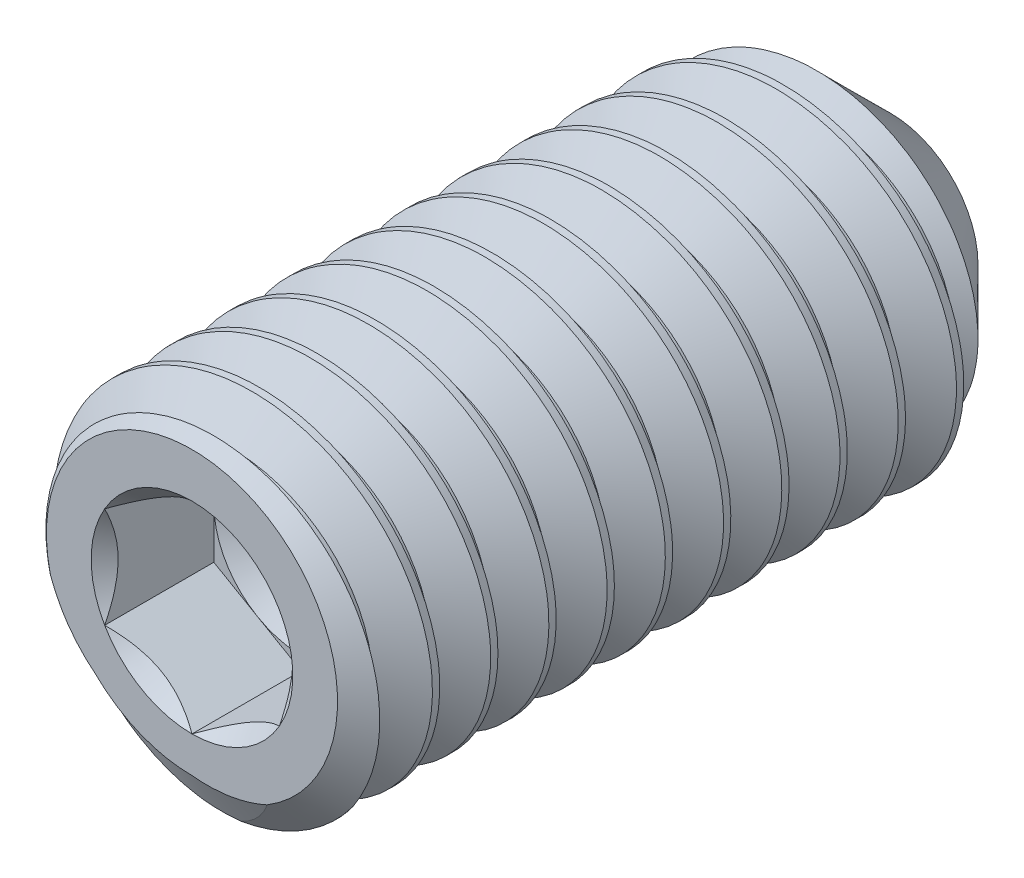
from build123d import *

# Parameters (mm, degrees)
CUT_EXTRUDE1_DEPTH = 0.9375
CUT_SWEEP1_PITCH   = 0.5


with BuildPart() as part:
    # Sketch11 → Revolve1 (revolve)
    with BuildSketch(Plane(origin=(0, 0, 0), x_dir=(0, 0, -1), z_dir=(1, 0, 0)), mode=Mode.PRIVATE) as revolve1_sk:
        Polygon((-3, 0), (-3, 1.25), (-2.824948115, 1.5), (2.25, 1.5), (3, 0.75), (2.549354536, 0), align=None)
    revolve(revolve1_sk.sketch.rotate(Axis((0, 0, -2.549354536), (0, 0, -1)), 180), axis=Axis((0, 0, -2.549354536), (0, 0, -1)))

    # Sketch2 → Cut-Extrude1 (cut)
    with BuildSketch(Plane.XY.offset(3)):
        Polygon((0, 0.866025404), (-0.75, 0.433012702), (-0.75, -0.433012702), (0, -0.866025404), (0.75, -0.433012702), (0.75, 0.433012702), align=None)
    extrude(amount=-CUT_EXTRUDE1_DEPTH, mode=Mode.SUBTRACT)

    # Cut-Extrude2 cone 1 section (through the dimple's axis) → Cut-Extrude2 (revolve, cut)
    with BuildSketch(Plane(origin=(0, 0, 3), x_dir=(0, -1, 0), z_dir=(1, 0, 0))):
        Polygon((0, 0), (0.866025404, 0), (0, 0.866025404), align=None)
    revolve(axis=Axis((0, 0, 3), (0, 0, -1)), mode=Mode.SUBTRACT)

    # Cut-Extrude3 cone 1 section (through the dimple's axis) → Cut-Extrude3 (revolve, cut)
    with BuildSketch(Plane(origin=(0, 0, 2.0625), x_dir=(0, -1, 0), z_dir=(1, 0, 0))):
        Polygon((0, 0), (0.75, 0), (0, 0.433012702), align=None)
    revolve(axis=Axis((0, 0, 2.0625), (0, 0, -1)), mode=Mode.SUBTRACT)

    # Cut-Sweep1: the profile of Sketch6 screwed along a right-hand helix of 13.2 turns, 6 arcs to a turn; built about Z, then put on its axis
    cut_sweep1_z = Axis((0, 0, 0), (0, 0, 1))
    cut_sweep1_corners = [(1.175240474, 0, -0.1875), (1.527063294, 0, 0.015625), (1.527063294, 0, -0.453125), (1.175240474, 0, -0.25)]
    with BuildLine(mode=Mode.PRIVATE) as cut_sweep1_profile:
        Line(cut_sweep1_corners[0], cut_sweep1_corners[1])
        Line(cut_sweep1_corners[1], cut_sweep1_corners[2])
        Line(cut_sweep1_corners[2], cut_sweep1_corners[3])
        Line(cut_sweep1_corners[3], cut_sweep1_corners[0])
    cut_sweep1_cap = Face(cut_sweep1_profile.wire())
    cut_sweep1_turn_angles = [0, 30, 60, 90, 120, 150, 180, 210, 240, 270, 300, 330, 360]
    cut_sweep1_turn_weights = [1, 0.8660254037844387, 1, 0.8660254037844387, 1, 0.8660254037844387, 1, 0.8660254037844387, 1, 0.8660254037844387, 1, 0.8660254037844387, 1]
    cut_sweep1_turn_rails = [Edge.make_bspline([Vector(p[0], p[1], 0).rotate(cut_sweep1_z, cut_sweep1_turn_angles[k]) / cut_sweep1_turn_weights[k] + Vector(0, 0, p[2] + CUT_SWEEP1_PITCH * cut_sweep1_turn_angles[k] / 360) for k in range(13)], [0, 0, 0, 1, 1, 2, 2, 3, 3, 4, 4, 5, 5, 6, 6, 6], 2, cut_sweep1_turn_weights) for p in cut_sweep1_corners]
    cut_sweep1_turn_sides = [Face.make_surface_from_curves(cut_sweep1_turn_rails[p[0]], cut_sweep1_turn_rails[p[1]]) for p in [(0, 1), (1, 2), (2, 3), (3, 0)]]
    cut_sweep1_last_angles = [4680, 4710, 4740, 4746, 4752]
    cut_sweep1_last_weights = [1, 0.8660254037844387, 1, 0.9945218953682651, 1]
    cut_sweep1_last_rails = [Edge.make_bspline([Vector(p[0], p[1], 0).rotate(cut_sweep1_z, cut_sweep1_last_angles[k]) / cut_sweep1_last_weights[k] + Vector(0, 0, p[2] + CUT_SWEEP1_PITCH * cut_sweep1_last_angles[k] / 360) for k in range(5)], [0, 0, 0, 1, 1, 2, 2, 2], 2, cut_sweep1_last_weights) for p in cut_sweep1_corners]
    cut_sweep1_last_sides = [Face.make_surface_from_curves(cut_sweep1_last_rails[p[0]], cut_sweep1_last_rails[p[1]]) for p in [(0, 1), (1, 2), (2, 3), (3, 0)]]
    cut_sweep1 = Plane(origin=(0, 0, -3), x_dir=(0, 1, 0), z_dir=(0, 0, 1)) * Solid(Shell([*[p.moved(Location((0, 0, CUT_SWEEP1_PITCH * i))) for i in range(13) for p in cut_sweep1_turn_sides], *cut_sweep1_last_sides, cut_sweep1_cap, cut_sweep1_cap.rotate(cut_sweep1_z, 4752).moved(Location((0, 0, CUT_SWEEP1_PITCH * 4752 / 360)))]))
    add(cut_sweep1, mode=Mode.SUBTRACT)


solid = part.part
